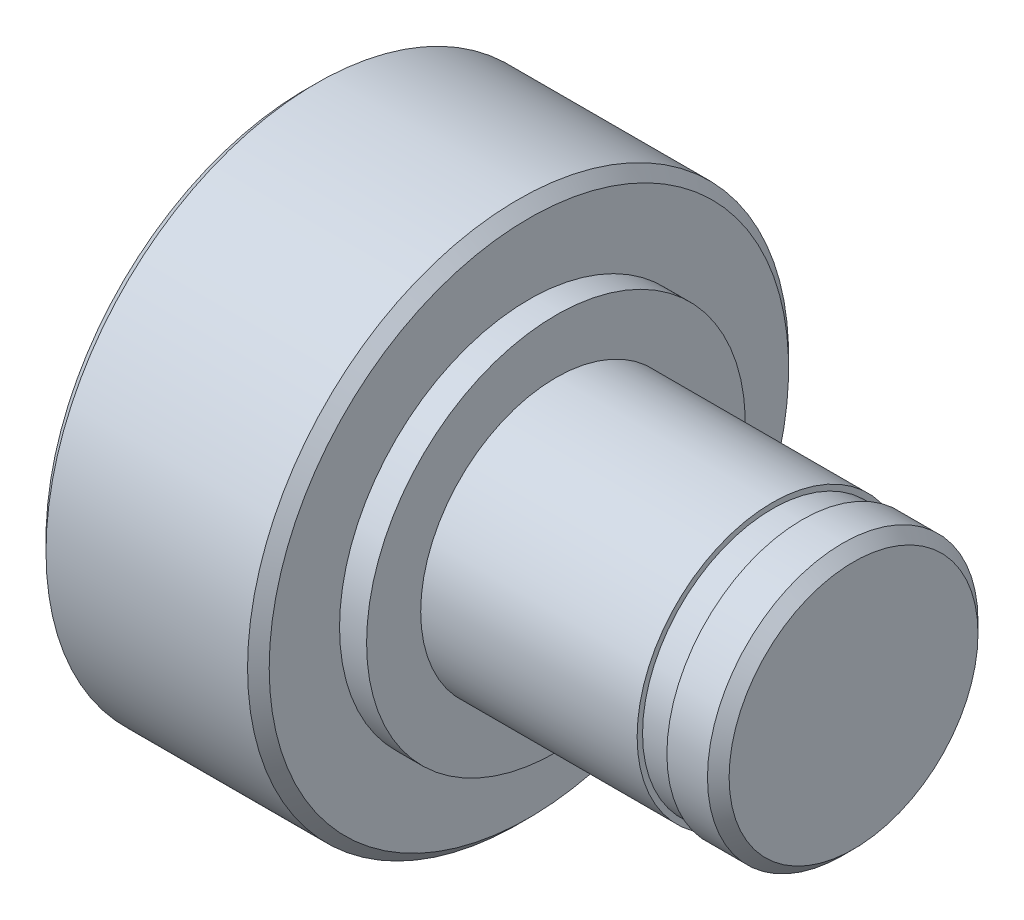
from build123d import *

# Parameters (mm, degrees)
CHAMFER1_SIZE = 0.4
SKETCH2_W     = 1.1
SKETCH2_H     = 0.2


with BuildPart() as part:
    # Sketch1 → Revolve1 (revolve)
    with BuildSketch(Plane(origin=(0, 0, 0), x_dir=(1, 0, 0), z_dir=(0, 1, 0))):
        Polygon((0, 0), (0, 10), (8.25, 10), (8.25, 7), (9.25, 7), (9.25, 5), (20.25, 5), (20.25, 0), align=None)
    revolve(axis=Axis((0, 0, 0), (1, 0, 0)))

    # Chamfer1
    chamfer1_edges = [part.edges().sort_by_distance(p)[0] for p in [
        (8.25, 0, 10),
        (20.25, 0, 5),
        (0, 0, 10),
    ]]
    chamfer(chamfer1_edges, length=CHAMFER1_SIZE)

    # Sketch2 → Cut-Revolve1 (revolve, cut)
    with BuildSketch(Plane(origin=(0, 0, 0), x_dir=(1, 0, 0), z_dir=(0, 1, 0))):
        with Locations((17.8, 4.9)):
            Rectangle(SKETCH2_W, SKETCH2_H)
    revolve(axis=Axis((9.25, 0, 0), (1, 0, 0)), mode=Mode.SUBTRACT)


solid = part.part
